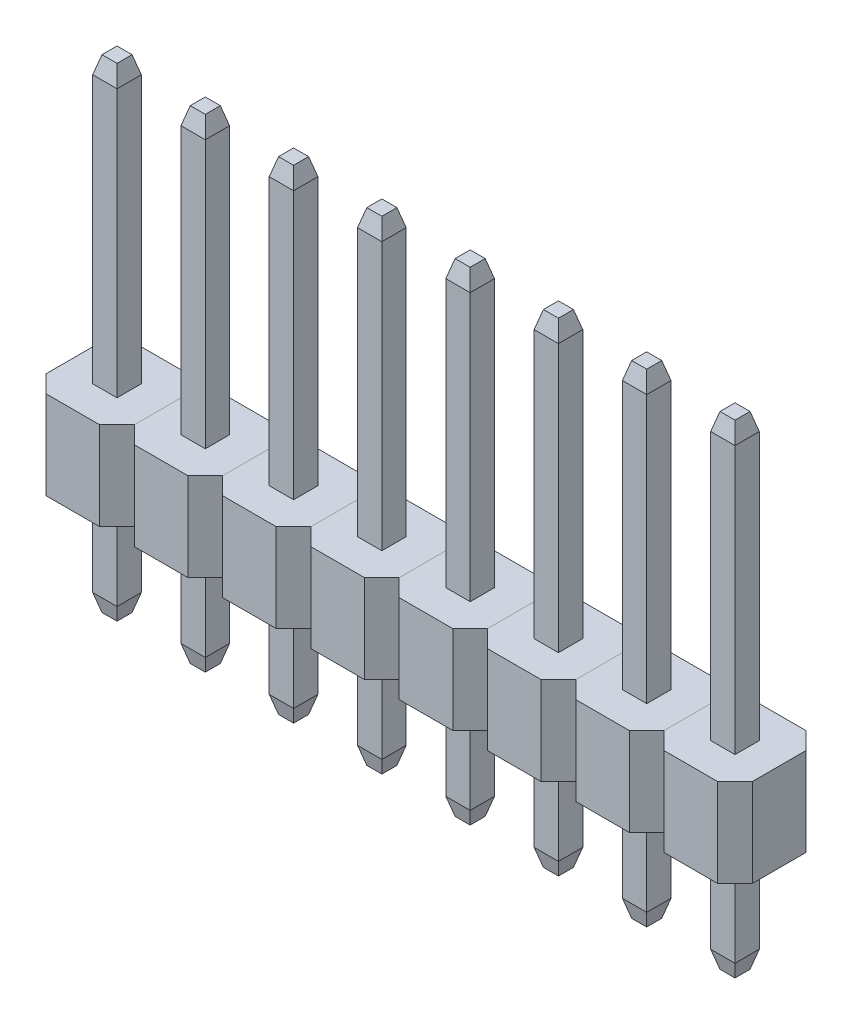
from build123d import *

# Parameters (mm, degrees)
SKETCH3_W           = 2.54
SKETCH3_H           = 2.54
SKETCH3_W_2         = 0.635
SKETCH3_H_2         = 0.635
BOSS_EXTRUDE1_DEPTH = 1.27
CHAMFER1_SIZE       = 0.5
BOSS_EXTRUDE2_START = -5.2
SKETCH5_W           = 0.7
SKETCH5_H           = 0.7
BOSS_EXTRUDE2_DEPTH = 12.9
SKETCH6_W           = 0.7
SKETCH6_H           = 0.7
BOSS_EXTRUDE3_DEPTH = 0.5
BOSS_EXTRUDE3_TAPER = 15
SKETCH7_W           = 0.7
SKETCH7_H           = 0.7
BOSS_EXTRUDE4_DEPTH = 0.5
BOSS_EXTRUDE4_TAPER = 15
LPATTERN1_COUNT     = 8
LPATTERN1_PITCH     = 2.54


with BuildPart() as part:
    # Sketch3 → Boss-Extrude1 (new, symmetric)
    with BuildSketch(Plane(origin=(0, 0, 0), x_dir=(1, 0, 0), z_dir=(0, 1, 0))):
        Rectangle(SKETCH3_W, SKETCH3_H)
        Rectangle(SKETCH3_W_2, SKETCH3_H_2, mode=Mode.SUBTRACT)
    extrude(amount=BOSS_EXTRUDE1_DEPTH, both=True)

    # Chamfer1
    chamfer1_edges = [part.edges().sort_by_distance(p)[0] for p in [
        (-1.27, 0, 1.27),
        (-1.27, 0, -1.27),
        (1.27, 0, -1.27),
        (1.27, 0, 1.27),
    ]]
    chamfer(chamfer1_edges, length=CHAMFER1_SIZE)


with BuildPart() as body_2:
    # Sketch5 → Boss-Extrude2 (new body)
    with BuildSketch(Plane(origin=(0, 1.27, 0), x_dir=(1, 0, 0), z_dir=(0, 1, 0)).offset(BOSS_EXTRUDE2_START)):
        Rectangle(SKETCH5_W, SKETCH5_H)
    extrude(amount=BOSS_EXTRUDE2_DEPTH)

    # Sketch6 → Boss-Extrude3 (add)
    with BuildSketch(Plane(origin=(0, 8.97, 0), x_dir=(1, 0, 0), z_dir=(0, 1, 0))):
        Rectangle(SKETCH6_W, SKETCH6_H)
    extrude(amount=BOSS_EXTRUDE3_DEPTH, taper=BOSS_EXTRUDE3_TAPER)

    # Sketch7 → Boss-Extrude4 (add)
    with BuildSketch(Plane.XZ.offset(3.93)):
        Rectangle(SKETCH7_W, SKETCH7_H)
    extrude(amount=BOSS_EXTRUDE4_DEPTH, taper=BOSS_EXTRUDE4_TAPER)


with BuildPart() as lpattern1_1:
    # LPattern1: pattern copy
    add(part.part.moved(Location(Vector(1, 0, 0) * (1 * LPATTERN1_PITCH))))


with BuildPart() as lpattern1_2:
    # LPattern1: pattern copy
    add(part.part.moved(Location(Vector(1, 0, 0) * (2 * LPATTERN1_PITCH))))


with BuildPart() as lpattern1_3:
    # LPattern1: pattern copy
    add(part.part.moved(Location(Vector(1, 0, 0) * (3 * LPATTERN1_PITCH))))


with BuildPart() as lpattern1_4:
    # LPattern1: pattern copy
    add(part.part.moved(Location(Vector(1, 0, 0) * (4 * LPATTERN1_PITCH))))


with BuildPart() as lpattern1_5:
    # LPattern1: pattern copy
    add(part.part.moved(Location(Vector(1, 0, 0) * (5 * LPATTERN1_PITCH))))


with BuildPart() as lpattern1_6:
    # LPattern1: pattern copy
    add(part.part.moved(Location(Vector(1, 0, 0) * (6 * LPATTERN1_PITCH))))


with BuildPart() as lpattern1_7:
    # LPattern1: pattern copy
    add(part.part.moved(Location(Vector(1, 0, 0) * (7 * LPATTERN1_PITCH))))


with BuildPart() as lpattern1_8:
    # LPattern1: pattern copy
    add(body_2.part.moved(Location(Vector(1, 0, 0) * (1 * LPATTERN1_PITCH))))


with BuildPart() as lpattern1_9:
    # LPattern1: pattern copy
    add(body_2.part.moved(Location(Vector(1, 0, 0) * (2 * LPATTERN1_PITCH))))


with BuildPart() as lpattern1_10:
    # LPattern1: pattern copy
    add(body_2.part.moved(Location(Vector(1, 0, 0) * (3 * LPATTERN1_PITCH))))


with BuildPart() as lpattern1_11:
    # LPattern1: pattern copy
    add(body_2.part.moved(Location(Vector(1, 0, 0) * (4 * LPATTERN1_PITCH))))


with BuildPart() as lpattern1_12:
    # LPattern1: pattern copy
    add(body_2.part.moved(Location(Vector(1, 0, 0) * (5 * LPATTERN1_PITCH))))


with BuildPart() as lpattern1_13:
    # LPattern1: pattern copy
    add(body_2.part.moved(Location(Vector(1, 0, 0) * (6 * LPATTERN1_PITCH))))


with BuildPart() as lpattern1_14:
    # LPattern1: pattern copy
    add(body_2.part.moved(Location(Vector(1, 0, 0) * (7 * LPATTERN1_PITCH))))


solid = Compound([part.part, body_2.part, lpattern1_1.part, lpattern1_2.part, lpattern1_3.part, lpattern1_4.part, lpattern1_5.part, lpattern1_6.part, lpattern1_7.part, lpattern1_8.part, lpattern1_9.part, lpattern1_10.part, lpattern1_11.part, lpattern1_12.part, lpattern1_13.part, lpattern1_14.part])
